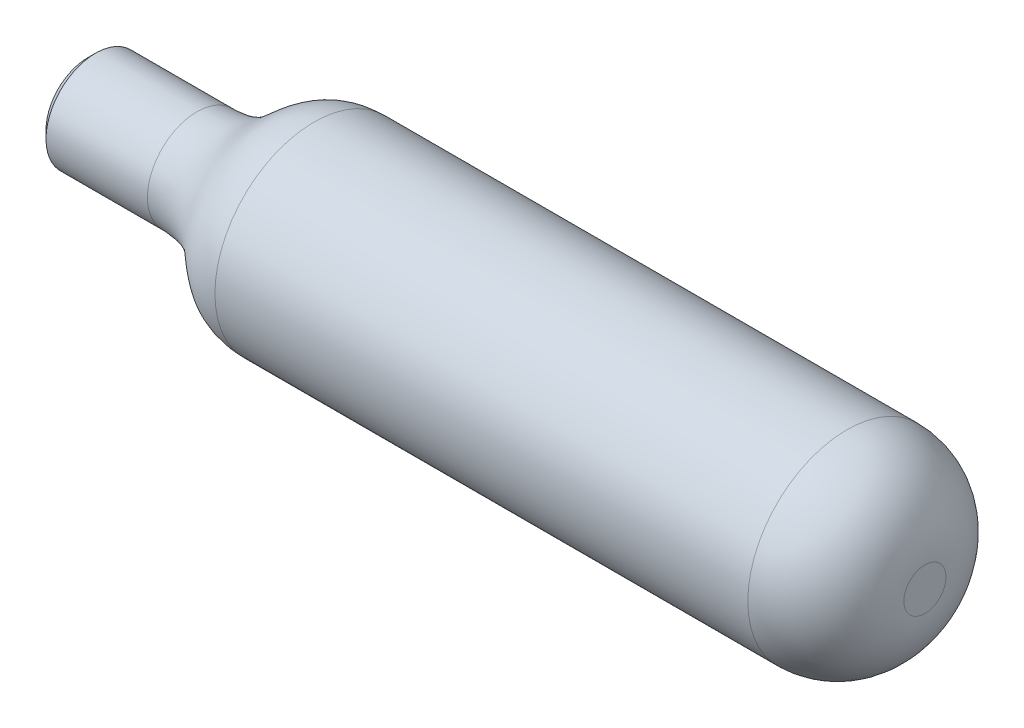
from build123d import *


with BuildPart() as part:
    # revolution body → Revolve1 (revolve)
    with BuildSketch(Plane.XY):
        with BuildLine():
            Line((-67.034317062, 8.819371739), (-54.034317062, 8.819371739))
            add(Edge.make_bspline(
                [(-54.034317062, 8.819371739), (-45.639917935, 8.716149455), (-46.425076057, 15.031715968), (-39.034317062, 15.169371739)],
                knots=[0, 0, 0, 0, 1, 1, 1, 1], degree=3))
            Line((-39.034317062, 15.169371739), (29.265682938, 15.169371739))
            ThreePointArc((29.265682938, 15.169371739), (36.33675075, 12.24043955), (39.265682938, 5.169371739))
            Line((39.265682938, 5.169371739), (39.265682938, 2.469371739))
            Line((39.265682938, 2.469371739), (-68.034317062, 2.469371739))
            Line((-68.034317062, 2.469371739), (-68.034317062, 7.819371739))
            Line((-68.034317062, 7.819371739), (-67.034317062, 8.819371739))
        make_face()
    revolve(axis=Axis((-68.034317062, 2.469371739, 0), (1, 0, 0)))


solid = part.part
